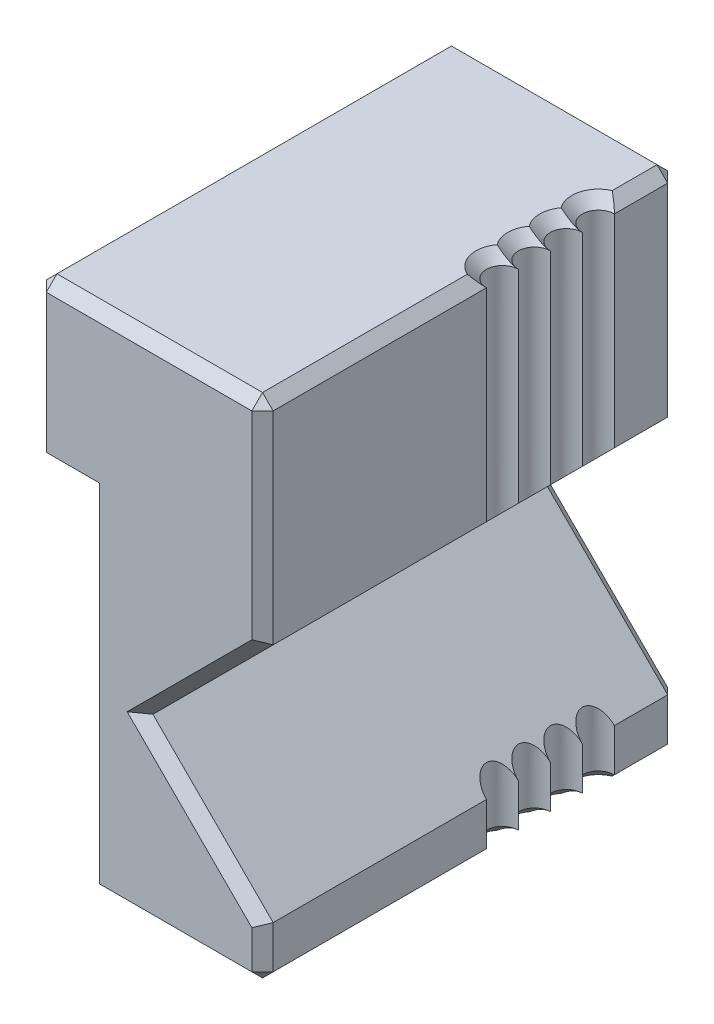
from build123d import *

# Parameters (mm, degrees)
BOSS_EXTRUDE1_DEPTH = 39
SKETCH2_R           = 1.5
CUT_EXTRUDE1_DEPTH  = 66.080017127
LPATTERN2_COUNT     = 10
LPATTERN2_PITCH     = 3
CHAMFER2_SIZE       = 1


with BuildPart() as part:
    # Sketch1 → Boss-Extrude1 (new body)
    with BuildSketch(Plane.XY):
        Polygon((-11.27835316, 0), (0, 11.27835316), (0, 31.27835316), (-21.27835316, 31.27835316), (-21.27835316, 16.27835316), (-16.27835316, 16.27835316), (-16.27835316, -16.27835316), (0, -16.27835316), (0, -11.27835316), align=None)
    extrude(amount=BOSS_EXTRUDE1_DEPTH)

    # Sketch2 → Cut-Extrude1 (cut, through all)
    with BuildSketch(Plane(origin=(0, 31.27835316, 0), x_dir=(1, 0, 0), z_dir=(0, 1, 0))):
        with Locations((0, -7.5)):
            Circle(SKETCH2_R)
    cut_extrude1 = extrude(amount=-CUT_EXTRUDE1_DEPTH, mode=Mode.SUBTRACT)

    # LPattern2: Cut-Extrude1 ×10, 6 skipped
    with Locations(*[(0, 0, i * LPATTERN2_PITCH) for i in range(1, LPATTERN2_COUNT) if i not in (4, 5, 6, 7, 8, 9)]):
        add(cut_extrude1, mode=Mode.SUBTRACT)

    # Chamfer2
    chamfer2_edges = [part.edges().sort_by_distance(p)[0] for p in [
        (-1.5, 31.27835316, 16.5),
        (-1.5, 31.27835316, 13.5),
        (-1.5, 31.27835316, 10.5),
        (-1.5, 31.27835316, 7.5),
        (0, 31.27835316, 3),
        (-1.5, -16.27835316, 16.5),
        (-1.5, -16.27835316, 13.5),
        (-1.5, -16.27835316, 10.5),
        (-1.5, -16.27835316, 7.5),
        (0, -16.27835316, 3),
        (0, -13.77835316, 39),
        (-8.13917658, -16.27835316, 39),
        (-18.77835316, 16.27835316, 39),
        (-5.63917658, -5.63917658, 39),
        (-5.63917658, 5.63917658, 39),
        (0, 21.27835316, 39),
        (-10.63917658, 31.27835316, 39),
        (-5.63917658, 5.63917658, 0),
        (0, 21.27835316, 0),
        (-10.63917658, 31.27835316, 0),
        (-21.27835316, 31.27835316, 19.5),
        (-21.27835316, 23.77835316, 39),
        (-21.27835316, 16.27835316, 19.5),
        (-21.27835316, 23.77835316, 0),
        (-18.77835316, 16.27835316, 0),
        (-5.63917658, -5.63917658, 0),
        (0, -13.77835316, 0),
        (-8.13917658, -16.27835316, 0),
        (-16.27835316, 0, 39),
        (-16.27835316, -16.27835316, 19.5),
        (-16.27835316, 0, 0),
        (0, 31.27835316, 28.5),
        (0, -16.27835316, 28.5),
    ]]
    chamfer(chamfer2_edges, length=CHAMFER2_SIZE)


solid = part.part
